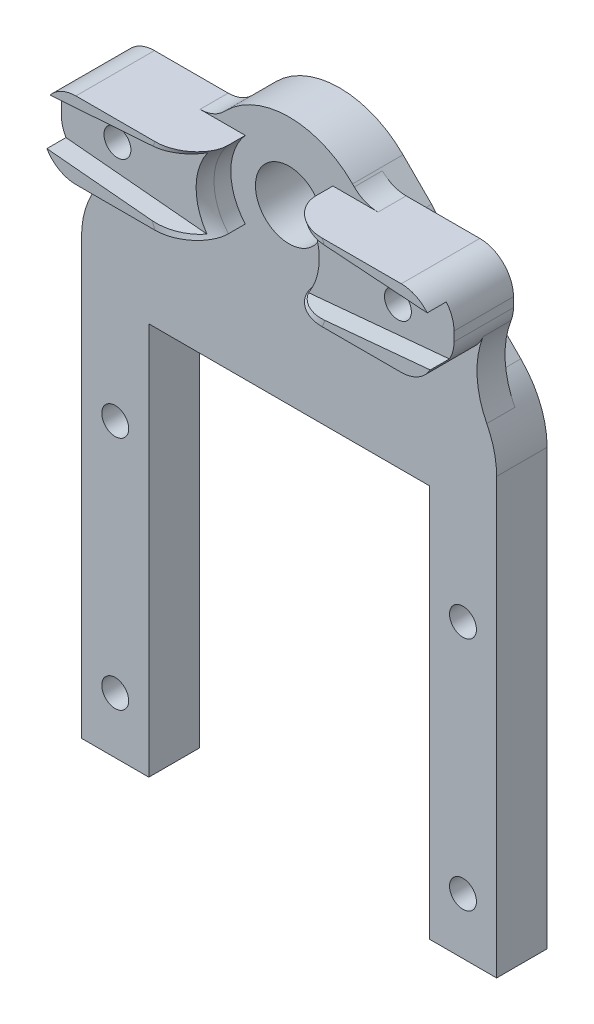
from build123d import *

# Parameters (mm, degrees)
SKETCH_1_R           = 3
SKETCH_1_R_2         = 1.2
EXTRUDE_1_DEPTH      = 4.5
EXTRUDE_2_DEPTH      = 4.5
EXTRUDE_2_DEPTH_BACK = 2.5
SKETCH_2_R           = 1.2
FILLET_1_R           = 8
CUT_EXTRUDE_1_REACH  = 62.544
SKETCH_3_R           = 3.421397557
FILLET_2_R           = 3
CUT_EXTRUDE_2_DEPTH  = 1.7
FILLET_START         = 2
FILLET_3_DEPTH       = 2.5


with BuildPart() as part:
    # 草图1 → 凸台-拉伸1 (new body)
    with BuildSketch(Plane.XY):
        Polygon((-12.5, 0), (-18.5, 0), (-18.5, 42.034916596), (0, 60.534916596), (18.5, 42.034916596), (18.5, 0), (12.5, 0), (12.5, 35), (-12.5, 35), align=None)
        with Locations((0, 50.421397557)):
            Circle(SKETCH_1_R, mode=Mode.SUBTRACT)
        with Locations((-15.5, 5)):
            Circle(SKETCH_1_R_2, mode=Mode.SUBTRACT)
        with Locations((-15.5, 26)):
            Circle(SKETCH_1_R_2, mode=Mode.SUBTRACT)
        with Locations(Location((15.5, 5, 0), (0, 0, 180))):
            Circle(SKETCH_1_R_2, mode=Mode.SUBTRACT)
        with Locations(Location((15.5, 26, 0), (0, 0, 180))):
            Circle(SKETCH_1_R_2, mode=Mode.SUBTRACT)
    extrude(amount=EXTRUDE_1_DEPTH)

    # 草图2 → 凸台-拉伸2 (add, two sides: drawn at the far end of the back side and taken through both)
    # profile 1 of 2: a face of its own
    with BuildSketch(Plane.XY.offset(4.5).offset(-EXTRUDE_2_DEPTH_BACK)):
        with BuildLine():
            Line((17.5, 47), (3.906515802, 47))
            ThreePointArc((3.906515802, 47), (5.192959363, 50.421397557), (3.906515802, 53.842795113))
            Line((3.906515802, 53.842795113), (17.5, 53.842795113))
            Line((17.5, 53.842795113), (17.5, 47))
        make_face()
        with Locations(Location((12.5, 50.421397557, 0), (0, 0, 180))):
            Circle(SKETCH_2_R, mode=Mode.SUBTRACT)
    # profile 2 of 2: a face of its own
    with BuildSketch(Plane.XY.offset(4.5).offset(-EXTRUDE_2_DEPTH_BACK)):
        with BuildLine():
            Line((-17.5, 47), (-17.5, 53.842795113))
            Line((-17.5, 53.842795113), (-3.906515802, 53.842795113))
            ThreePointArc((-3.906515802, 53.842795113), (-5.192959363, 50.421397557), (-3.906515802, 47))
            Line((-3.906515802, 47), (-17.5, 47))
        make_face()
        with Locations((-12.5, 50.421397557)):
            Circle(SKETCH_2_R, mode=Mode.SUBTRACT)
    extrude(amount=EXTRUDE_2_DEPTH + EXTRUDE_2_DEPTH_BACK)

    # 圆角1
    fillet_1_edges = [part.edges().sort_by_distance(p)[0] for p in [
        (-18.5, 42.034916596, 2.25),
        (0, 60.534916596, 2.25),
        (18.5, 42.034916596, 2.25),
    ]]
    fillet(fillet_1_edges, radius=FILLET_1_R)

    # 草图3 → 切除-拉伸1 (cut, up to next)
    with BuildSketch(Plane(origin=(0, 0, 2), x_dir=(-1, 0, 0), z_dir=(0, 0, -1)), mode=Mode.PRIVATE) as cut_extrude_1_sk1:
        with Locations((-12.5, 50.421397557)):
            Circle(SKETCH_3_R)
    cut_extrude_1_tool1 = extrude(cut_extrude_1_sk1.sketch, amount=CUT_EXTRUDE_1_REACH, mode=Mode.PRIVATE) & part.part
    # 草图3 → 切除-拉伸1 (cut, up to next)
    with BuildSketch(Plane(origin=(0, 0, 2), x_dir=(-1, 0, 0), z_dir=(0, 0, -1)), mode=Mode.PRIVATE) as cut_extrude_1_sk2:
        with Locations((12.5, 50.421397557)):
            Circle(SKETCH_3_R)
    cut_extrude_1_tool2 = extrude(cut_extrude_1_sk2.sketch, amount=CUT_EXTRUDE_1_REACH, mode=Mode.PRIVATE) & part.part
    add(cut_extrude_1_tool1.solids().sort_by_distance((12.5, 50.421398, 2))[0], mode=Mode.SUBTRACT)
    add(cut_extrude_1_tool2.solids().sort_by_distance((-12.5, 50.421398, 2))[0], mode=Mode.SUBTRACT)

    # 圆角2
    fillet_2_edges = [part.edges().sort_by_distance(p)[0] for p in [
        (9.202203088, 51.332713509, 1),
        (-9.202203088, 51.332713509, 1),
        (-6.692121483, 53.842795113, 3.25),
        (-17.5, 47, 5.5),
        (-5.192959363, 50.421397557, 9),
        (-17.5, 53.842795113, 5.5),
        (6.692121483, 53.842795113, 3.25),
        (17.5, 53.842795113, 5.5),
        (5.192959363, 50.421397557, 9),
        (17.5, 47, 5.5),
    ]]
    fillet(fillet_2_edges, radius=FILLET_2_R)

    # 草图4 → 切除-拉伸2 (cut)
    with BuildSketch(Plane.XY.offset(9)):
        Polygon((0, 46.899022366), (43.079074711, 50.891584803), (0, 53.943772747), (-43.079074711, 50.891584803), align=None)
    extrude(amount=-CUT_EXTRUDE_2_DEPTH, mode=Mode.SUBTRACT)

    # 圆角3: read off the stored shape, not the designer's step
    # 圆角3 outline → 圆角3 (add)
    with BuildSketch(Plane.XY.offset(FILLET_START)):
        with BuildLine():
            ThreePointArc((17.623806552, 42.361452624), (16.757691875, 45.600251323), (17.294803574, 48.909553768))
            ThreePointArc((17.294803574, 48.909553768), (16.192433353, 47.52297167), (14.5, 47))
            Line((14.5, 47), (13.534916596, 47))
            Line((13.534916596, 47), (16.156854249, 44.378062347))
            ThreePointArc((16.156854249, 44.378062347), (16.969389563, 43.42726788), (17.623806552, 42.361452624))
        make_face()
        with BuildLine():
            ThreePointArc((-14.5, 47), (-16.192433353, 47.52297167), (-17.294803574, 48.909553768))
            ThreePointArc((-17.294803574, 48.909553768), (-16.757691875, 45.600251323), (-17.623806552, 42.361452624))
            ThreePointArc((-17.623806552, 42.361452624), (-16.969389563, 43.42726788), (-16.156854249, 44.378062347))
            Line((-16.156854249, 44.378062347), (-13.534916596, 47))
            Line((-13.534916596, 47), (-14.5, 47))
        make_face()
    extrude(amount=FILLET_3_DEPTH)


solid = part.part
